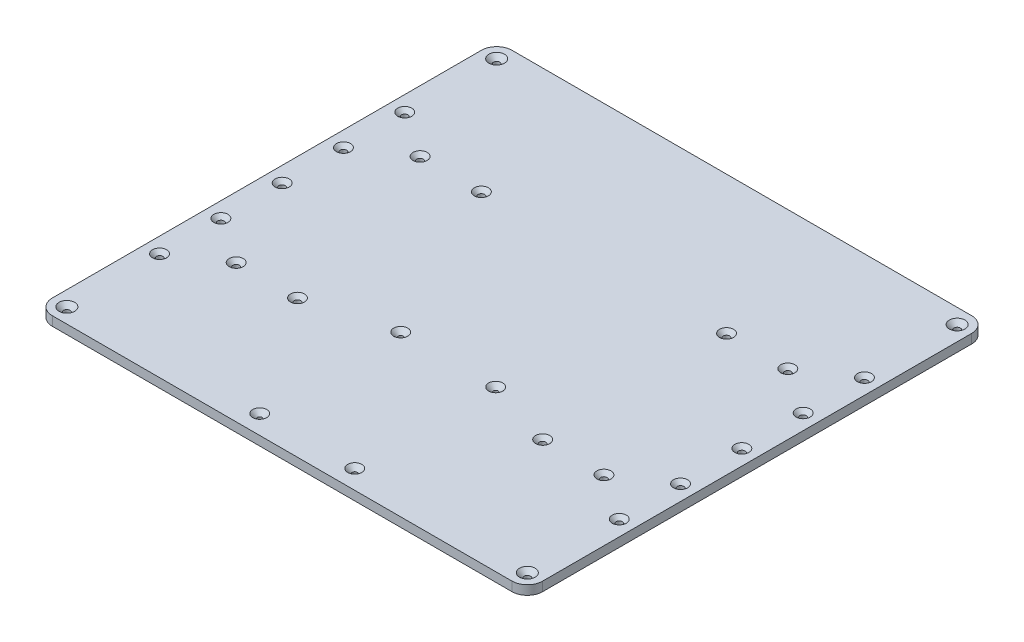
from build123d import *

# Parameters (mm, degrees)
EXTRUDE_1_DEPTH     = 3
SKETCH_5_R          = 2.1
CUT_EXTRUDE_4_DEPTH = 240
CHAMFER_2_SIZE      = 2.5
SKETCH_6_R          = 2.1
CUT_EXTRUDE_5_DEPTH = 10
CHAMFER_3_SIZE      = 3
SKETCH_7_R          = 2.1
CUT_EXTRUDE_6_DEPTH = 10
CHAMFER_4_SIZE      = 3
SKETCH_8_W          = 25.785951324
SKETCH_8_H          = 14.972487866
EXTRUDE_2_DEPTH     = 6
SKETCH_9_R          = 1.6
CUT_EXTRUDE_7_DEPTH = 10
CHAMFER_5_SIZE      = 3


with BuildPart() as part:
    # 草图1 → 凸台-拉伸1 (new, symmetric)
    with BuildSketch(Plane(origin=(0, 0, 0), x_dir=(1, 0, 0), z_dir=(0, 1, 0))):
        with BuildLine():
            Line((-150, -150), (150, -150))
            ThreePointArc((150, -150), (157.071067812, -147.071067812), (160, -140))
            Line((160, -140), (160, 140))
            ThreePointArc((160, 140), (157.071067812, 147.071067812), (150, 150))
            Line((150, 150), (-150, 150))
            ThreePointArc((-150, 150), (-157.071067812, 147.071067812), (-160, 140))
            Line((-160, 140), (-160, -140))
            ThreePointArc((-160, -140), (-157.071067812, -147.071067812), (-150, -150))
        make_face()
    extrude(amount=EXTRUDE_1_DEPTH, both=True)

    # 草图5 → 切除-拉伸4 (cut)
    with BuildSketch(Plane(origin=(0, 3, 0), x_dir=(1, 0, 0), z_dir=(0, 1, 0))):
        with Locations((80, 60)):
            Circle(SKETCH_5_R)
        with Locations((120, 60)):
            Circle(SKETCH_5_R)
        with Locations((-120, 60)):
            Circle(SKETCH_5_R)
        with Locations((-80, 60)):
            Circle(SKETCH_5_R)
        with Locations((-80, -60)):
            Circle(SKETCH_5_R)
        with Locations((-120, -60)):
            Circle(SKETCH_5_R)
        with Locations((120, -60)):
            Circle(SKETCH_5_R)
        with Locations((80, -60)):
            Circle(SKETCH_5_R)
        with Locations((-150, 0)):
            Circle(SKETCH_5_R)
        with Locations((-150, -40)):
            Circle(SKETCH_5_R)
        with Locations((-150, -80)):
            Circle(SKETCH_5_R)
        with Locations((-150, 80)):
            Circle(SKETCH_5_R)
        with Locations((-150, 40)):
            Circle(SKETCH_5_R)
        with Locations((150, 40)):
            Circle(SKETCH_5_R)
        with Locations((150, 80)):
            Circle(SKETCH_5_R)
        with Locations((150, -80)):
            Circle(SKETCH_5_R)
        with Locations((150, -40)):
            Circle(SKETCH_5_R)
        with Locations((150, 0)):
            Circle(SKETCH_5_R)
    extrude(amount=-CUT_EXTRUDE_4_DEPTH, mode=Mode.SUBTRACT)

    # 倒角2
    chamfer_2_edges = [part.edges().sort_by_distance(p)[0] for p in [
        (147.9, 3, 40),
        (147.9, 3, 80),
        (117.9, 3, 60),
        (77.9, 3, 60),
        (-82.1, 3, 60),
        (-122.1, 3, 60),
        (-152.1, 3, 80),
        (-152.1, 3, 40),
        (-152.1, 3, 0),
        (-152.1, 3, -40),
        (-152.1, 3, -80),
        (-122.1, 3, -60),
        (-82.1, 3, -60),
        (147.9, 3, 0),
        (147.9, 3, -40),
        (77.9, 3, -60),
        (117.9, 3, -60),
        (147.9, 3, -80),
    ]]
    chamfer(chamfer_2_edges, length=CHAMFER_2_SIZE)

    # 草图6 → 切除-拉伸5 (cut)
    with BuildSketch(Plane(origin=(0, 3, 0), x_dir=(1, 0, 0), z_dir=(0, 1, 0))):
        with Locations((-150.25, 140.25)):
            Circle(SKETCH_6_R)
        with Locations((150.25, 140.25)):
            Circle(SKETCH_6_R)
        with Locations((150.25, -140.25)):
            Circle(SKETCH_6_R)
        with Locations((-150.25, -140.25)):
            Circle(SKETCH_6_R)
    extrude(amount=-CUT_EXTRUDE_5_DEPTH, mode=Mode.SUBTRACT)

    # 倒角3
    chamfer_3_edges = [part.edges().sort_by_distance(p)[0] for p in [
        (148.15, 3, 140.25),
        (148.15, 3, -140.25),
        (-152.35, 3, -140.25),
        (-152.35, 3, 140.25),
    ]]
    chamfer(chamfer_3_edges, length=CHAMFER_3_SIZE)

    # 草图7 → 切除-拉伸6 (cut)
    with BuildSketch(Plane(origin=(0, -3, 0), x_dir=(-1, 0, 0), z_dir=(0, -1, 0))):
        with Locations((125, -100)):
            Circle(SKETCH_7_R)
    extrude(amount=-CUT_EXTRUDE_6_DEPTH, mode=Mode.SUBTRACT)

    # 倒角4
    chamfer_4_edges = [part.edges().sort_by_distance(p)[0] for p in [
        (-122.9, 3, 100),
    ]]
    chamfer(chamfer_4_edges, length=CHAMFER_4_SIZE)

    # 草图8 → 凸台-拉伸2 (add)
    with BuildSketch(Plane(origin=(0, 3, 0), x_dir=(1, 0, 0), z_dir=(0, 1, 0))):
        with Locations((-123.655101913, -100.590238672)):
            Rectangle(SKETCH_8_W, SKETCH_8_H)
    extrude(amount=-EXTRUDE_2_DEPTH)

    # 草图9 → 切除-拉伸7 (cut)
    with BuildSketch(Plane.XZ.offset(3)):
        with Locations((35, 137.63220059)):
            Circle(SKETCH_9_R)
        with Locations((35, 45.63220059)):
            Circle(SKETCH_9_R)
        with Locations((-27, 45.63220059)):
            Circle(SKETCH_9_R)
        with Locations((-27, 137.63220059)):
            Circle(SKETCH_9_R)
    extrude(amount=-CUT_EXTRUDE_7_DEPTH, mode=Mode.SUBTRACT)

    # 倒角5
    chamfer_5_edges = [part.edges().sort_by_distance(p)[0] for p in [
        (-28.6, 3, 137.63220059),
        (-28.6, 3, 45.63220059),
        (33.4, 3, 137.63220059),
        (33.4, 3, 45.63220059),
    ]]
    chamfer(chamfer_5_edges, length=CHAMFER_5_SIZE)


solid = part.part
